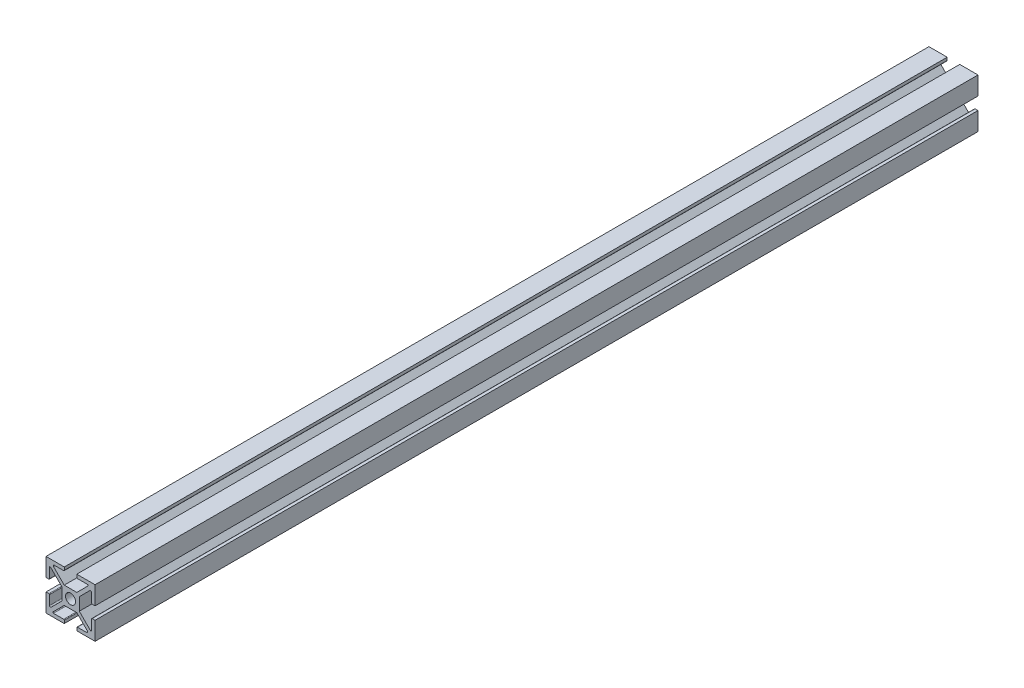
from build123d import *

# Parameters (mm, degrees)
SKETCH2_W           = 25.4
SKETCH2_H           = 25.4
BOSS_EXTRUDE2_DEPTH = 457.2
SKETCH3_R           = 2.6035
CUT_EXTRUDE2_DEPTH  = 458.55264178


with BuildPart() as part:
    # Sketch2 → Boss-Extrude2 (new body)
    with BuildSketch(Plane.XY):
        Rectangle(SKETCH2_W, SKETCH2_H)
    extrude(amount=BOSS_EXTRUDE2_DEPTH)

    # Sketch3 → Cut-Extrude2 (cut, through all)
    with BuildSketch(Plane.XY.offset(457.2)):
        Circle(SKETCH3_R)
        with BuildLine():
            Line((-3.2385, 12.7), (-3.2385, 11.207472774))
            ThreePointArc((-3.2385, 11.207472774), (-3.331856633, 10.982089925), (-3.557239482, 10.888733292))
            Line((-3.557239482, 10.888733292), (-8.381391428, 10.888733292))
            ThreePointArc((-8.381391428, 10.888733292), (-8.850722231, 10.575136475), (-8.740601673, 10.021523047))
            Line((-8.740601673, 10.021523047), (-3.25966412, 4.540585494))
            Line((-3.25966412, 4.540585494), (3.25966412, 4.540585494))
            Line((3.25966412, 4.540585494), (9.063689587, 10.344610961))
            ThreePointArc((9.063689587, 10.344610961), (9.132783621, 10.691970129), (8.838306738, 10.888733292))
            Line((8.838306738, 10.888733292), (3.557239482, 10.888733292))
            ThreePointArc((3.557239482, 10.888733292), (3.331856633, 10.982089925), (3.2385, 11.207472774))
            Line((3.2385, 11.207472774), (3.2385, 12.7))
            Line((3.2385, 12.7), (-3.2385, 12.7))
        make_face()
        with BuildLine():
            Line((12.7, 3.2385), (11.207472774, 3.2385))
            ThreePointArc((11.207472774, 3.2385), (10.982089925, 3.331856633), (10.888733292, 3.557239482))
            Line((10.888733292, 3.557239482), (10.888733292, 8.381391428))
            ThreePointArc((10.888733292, 8.381391428), (10.575136475, 8.850722231), (10.021523047, 8.740601673))
            Line((10.021523047, 8.740601673), (4.540585494, 3.25966412))
            Line((4.540585494, 3.25966412), (4.540585494, -3.25966412))
            Line((4.540585494, -3.25966412), (10.344610961, -9.063689587))
            ThreePointArc((10.344610961, -9.063689587), (10.691970129, -9.132783621), (10.888733292, -8.838306738))
            Line((10.888733292, -8.838306738), (10.888733292, -3.557239482))
            ThreePointArc((10.888733292, -3.557239482), (10.982089925, -3.331856633), (11.207472774, -3.2385))
            Line((11.207472774, -3.2385), (12.7, -3.2385))
            Line((12.7, -3.2385), (12.7, 3.2385))
        make_face()
        with BuildLine():
            Line((3.2385, -12.7), (3.2385, -11.207472774))
            ThreePointArc((3.2385, -11.207472774), (3.331856633, -10.982089925), (3.557239482, -10.888733292))
            Line((3.557239482, -10.888733292), (8.381391428, -10.888733292))
            ThreePointArc((8.381391428, -10.888733292), (8.850722231, -10.575136475), (8.740601673, -10.021523047))
            Line((8.740601673, -10.021523047), (3.25966412, -4.540585494))
            Line((3.25966412, -4.540585494), (-3.25966412, -4.540585494))
            Line((-3.25966412, -4.540585494), (-9.063689587, -10.344610961))
            ThreePointArc((-9.063689587, -10.344610961), (-9.132783621, -10.691970129), (-8.838306738, -10.888733292))
            Line((-8.838306738, -10.888733292), (-3.557239482, -10.888733292))
            ThreePointArc((-3.557239482, -10.888733292), (-3.331856633, -10.982089925), (-3.2385, -11.207472774))
            Line((-3.2385, -11.207472774), (-3.2385, -12.7))
            Line((-3.2385, -12.7), (3.2385, -12.7))
        make_face()
        with BuildLine():
            Line((-12.7, -3.2385), (-11.207472774, -3.2385))
            ThreePointArc((-11.207472774, -3.2385), (-10.982089925, -3.331856633), (-10.888733292, -3.557239482))
            Line((-10.888733292, -3.557239482), (-10.888733292, -8.381391428))
            ThreePointArc((-10.888733292, -8.381391428), (-10.575136475, -8.850722231), (-10.021523047, -8.740601673))
            Line((-10.021523047, -8.740601673), (-4.540585494, -3.25966412))
            Line((-4.540585494, -3.25966412), (-4.540585494, 3.25966412))
            Line((-4.540585494, 3.25966412), (-10.344610961, 9.063689587))
            ThreePointArc((-10.344610961, 9.063689587), (-10.691970129, 9.132783621), (-10.888733292, 8.838306738))
            Line((-10.888733292, 8.838306738), (-10.888733292, 3.557239482))
            ThreePointArc((-10.888733292, 3.557239482), (-10.982089925, 3.331856633), (-11.207472774, 3.2385))
            Line((-11.207472774, 3.2385), (-12.7, 3.2385))
            Line((-12.7, 3.2385), (-12.7, -3.2385))
        make_face()
    extrude(amount=-CUT_EXTRUDE2_DEPTH, mode=Mode.SUBTRACT)


solid = part.part
